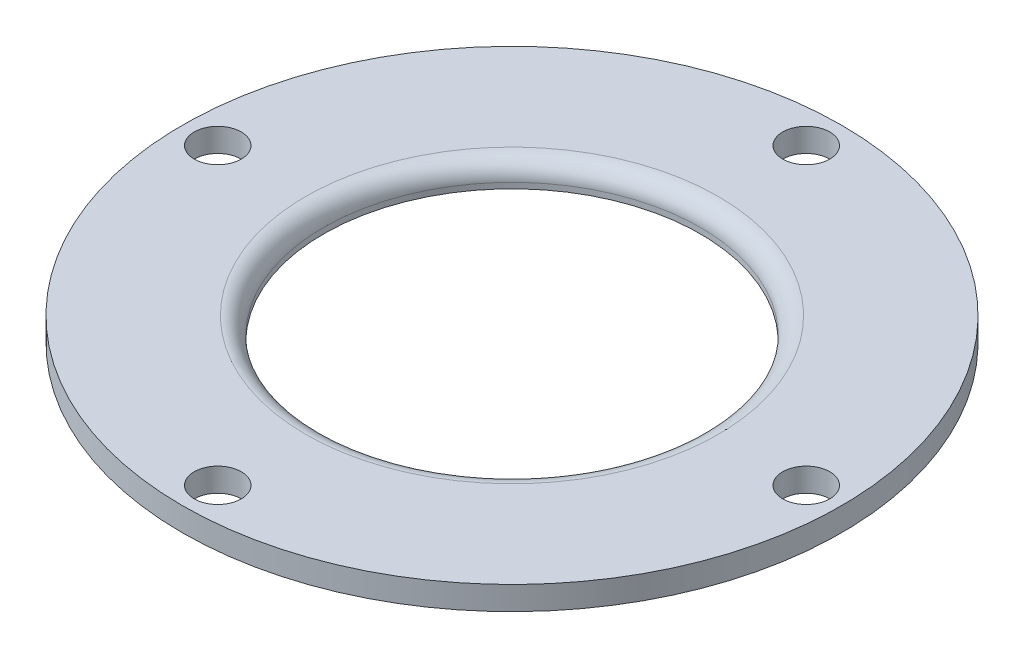
from build123d import *

# Parameters (mm, degrees)
SKETCH1_R           = 88.9
BOSS_EXTRUDE1_DEPTH = 6.35
SKETCH2_R           = 50.8
CUT_EXTRUDE1_DEPTH  = 126.88384527
FILLET2_R           = 4.826
SKETCH3_R           = 6.35
CUT_EXTRUDE2_DEPTH  = 126.88384527


with BuildPart() as part:
    # Sketch1 → Boss-Extrude1 (new body)
    with BuildSketch(Plane(origin=(0, 0, 0), x_dir=(1, 0, 0), z_dir=(0, 1, 0))):
        Circle(SKETCH1_R)
    extrude(amount=BOSS_EXTRUDE1_DEPTH)

    # Sketch2 → Cut-Extrude1 (cut, through all)
    with BuildSketch(Plane(origin=(0, 6.35, 0), x_dir=(1, 0, 0), z_dir=(0, 1, 0))):
        Circle(SKETCH2_R)
    extrude(amount=-CUT_EXTRUDE1_DEPTH, mode=Mode.SUBTRACT)

    # Fillet2
    fillet2_edges = [part.edges().sort_by_distance(p)[0] for p in [
        (-50.8, 6.35, 0),
    ]]
    fillet(fillet2_edges, radius=FILLET2_R)

    # Sketch3 → Cut-Extrude2 (cut, through all)
    with BuildSketch(Plane.XZ):
        with Locations((0, -79.375)):
            Circle(SKETCH3_R)
        with Locations((79.375, 0)):
            Circle(SKETCH3_R)
        with Locations((-79.375, 0)):
            Circle(SKETCH3_R)
        with Locations((0, 79.375)):
            Circle(SKETCH3_R)
    extrude(amount=-CUT_EXTRUDE2_DEPTH, mode=Mode.SUBTRACT)


solid = part.part
